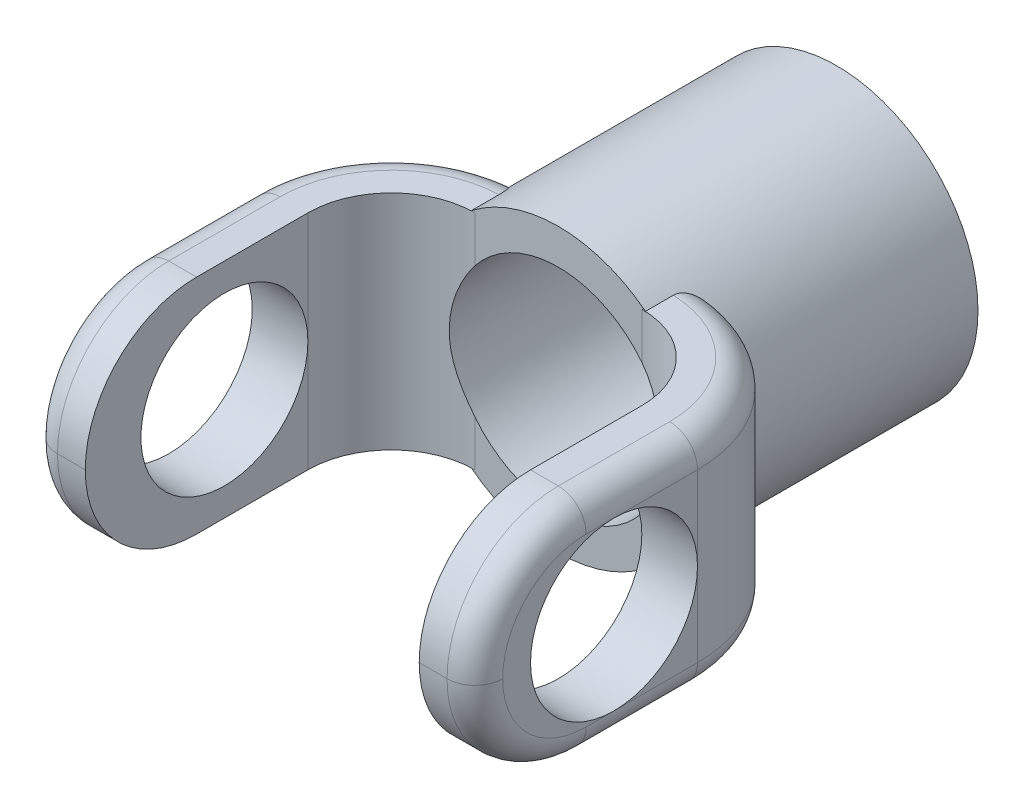
from build123d import *

# Parameters (mm, degrees)
BOSS_EXTRUDE1_DEPTH             = 10
CUT_EXTRUDE1_DEPTH              = 46.82575695
CUT_EXTRUDE1_DEPTH_BACK         = 46.82575695
SKETCH2_R                       = 7.5
SKETCH3_R                       = 12.7
SKETCH3_R_2                     = 9.525
BOSS_EXTRUDE2_DEPTH             = 20
BOSS_EXTRUDE2_DIRECTION_2_REACH = 41.449
CUT_EXTRUDE2_DEPTH              = 41.21865247
CUT_EXTRUDE2_DEPTH_BACK         = 41.21865247
FILLET1_R                       = 10
FILLET2_R                       = 2.5


with BuildPart() as part:
    # Sketch1 → Boss-Extrude1 (new, symmetric)
    with BuildSketch(Plane(origin=(0, 0, 0), x_dir=(1, 0, 0), z_dir=(0, 1, 0))):
        with BuildLine():
            Line((-20, 7.5), (-20, 0))
            Line((-20, 0), (-15, 0))
            Line((-15, 0), (-15, 7.5))
            ThreePointArc((-15, 7.5), (-12.803300859, 12.803300859), (-7.5, 15))
            Line((-7.5, 15), (7.5, 15))
            ThreePointArc((7.5, 15), (12.803300859, 12.803300859), (15, 7.5))
            Line((15, 7.5), (15, 0))
            Line((15, 0), (20, 0))
            Line((20, 0), (20, 7.5))
            ThreePointArc((20, 7.5), (16.338834765, 16.338834765), (7.5, 20))
            Line((7.5, 20), (-7.5, 20))
            ThreePointArc((-7.5, 20), (-16.338834765, 16.338834765), (-20, 7.5))
        make_face()
        Polygon((-15, 0), (-20, 0), (-20, -7.5), (-20, -12.5), (-15, -12.5), (-15, -7.5), align=None)
        Polygon((20, 0), (15, 0), (15, -7.5), (15, -12.5), (20, -12.5), (20, -7.5), align=None)
    extrude(amount=BOSS_EXTRUDE1_DEPTH, both=True)

    # Sketch2 → Cut-Extrude1 (cut, two sides: drawn at the far end of the back side and taken through both)
    with BuildSketch(Plane(origin=(20, 0, 0), x_dir=(0, 0, -1), z_dir=(1, 0, 0)).offset(-CUT_EXTRUDE1_DEPTH_BACK)):
        Circle(SKETCH2_R)
    extrude(amount=CUT_EXTRUDE1_DEPTH + CUT_EXTRUDE1_DEPTH_BACK, mode=Mode.SUBTRACT)

    # Sketch3 → Boss-Extrude2 (add)
    with BuildSketch(Plane(origin=(0, 0, -20), x_dir=(-1, 0, 0), z_dir=(0, 0, -1))):
        Circle(SKETCH3_R)
        Circle(SKETCH3_R_2, mode=Mode.SUBTRACT)
    extrude(amount=BOSS_EXTRUDE2_DEPTH)

    # Boss-Extrude2 direction 2: up to this face of the body (flat: up to its plane)
    boss_extrude2_direction_2_end = Plane(part.part.faces().sort_by_distance((0, 0, -15))[0])
    # Sketch3 → Boss-Extrude2 direction 2 (add, up to the picked face)
    with BuildSketch(Plane(origin=(0, 0, -20), x_dir=(-1, 0, 0), z_dir=(0, 0, -1)), mode=Mode.PRIVATE) as boss_extrude2_direction_2_sk1:
        Circle(SKETCH3_R)
        Circle(SKETCH3_R_2, mode=Mode.SUBTRACT)
    boss_extrude2_direction_2_tool1 = split(extrude(boss_extrude2_direction_2_sk1.sketch, amount=-BOSS_EXTRUDE2_DIRECTION_2_REACH, mode=Mode.PRIVATE), bisect_by=boss_extrude2_direction_2_end, keep=Keep.BOTH, mode=Mode.PRIVATE)
    add(boss_extrude2_direction_2_tool1.solids().sort_by(Axis((12.34079, 0, -20), (0, 0, 1)))[0])

    # Sketch3<2> → Cut-Extrude2 (cut, two sides: drawn at the far end of the back side and taken through both)
    with BuildSketch(Plane(origin=(0, 0, -20), x_dir=(-1, 0, 0), z_dir=(0, 0, -1)).offset(-CUT_EXTRUDE2_DEPTH_BACK)):
        with BuildLine():
            Line((7.5, -5.871594758), (7.5, 5.871594758))
            ThreePointArc((7.5, 5.871594758), (0, 9.525), (-7.5, 5.871594758))
            Line((-7.5, 5.871594758), (-7.5, -5.871594758))
            ThreePointArc((-7.5, -5.871594758), (0, -9.525), (7.5, -5.871594758))
        make_face()
        with BuildLine():
            Line((-7.5, -5.871594758), (-7.5, 5.871594758))
            ThreePointArc((-7.5, 5.871594758), (-9.525, 0), (-7.5, -5.871594758))
        make_face()
        with BuildLine():
            ThreePointArc((7.5, -5.871594758), (9.00453011, -3.105489092), (9.525, 0))
            ThreePointArc((9.525, 0), (9.00453011, 3.105489092), (7.5, 5.871594758))
            Line((7.5, 5.871594758), (7.5, -5.871594758))
        make_face()
    extrude(amount=CUT_EXTRUDE2_DEPTH + CUT_EXTRUDE2_DEPTH_BACK, mode=Mode.SUBTRACT)

    # Fillet1
    fillet1_edges = [part.edges().sort_by_distance(p)[0] for p in [
        (17.5, -10, 12.5),
        (-17.5, -10, 12.5),
        (-17.5, 10, 12.5),
        (17.5, 10, 12.5),
    ]]
    fillet(fillet1_edges, radius=FILLET1_R - 0.0001)  # a hair under: the kernel refuses the full size

    # Fillet2
    fillet2_edges = [part.edges().sort_by_distance(p)[0] for p in [
        (20, 10, -2.49995),
        (-20, -10, -2.49995),
        (-20, 10, -2.49995),
        (-20, 7.071097101, 9.571097101),
        (-20, -7.071097101, 9.571097101),
        (16.454326123, -10, -16.221814243),
        (-16.454326123, -10, -16.221814243),
        (-16.454326123, 10, -16.221814243),
        (16.454326123, 10, -16.221814243),
        (20, -10, -2.49995),
        (20, 7.071097101, 9.571097101),
    ]]
    fillet(fillet2_edges, radius=FILLET2_R - 0.0001)  # a hair under: the kernel refuses the full size


solid = part.part
